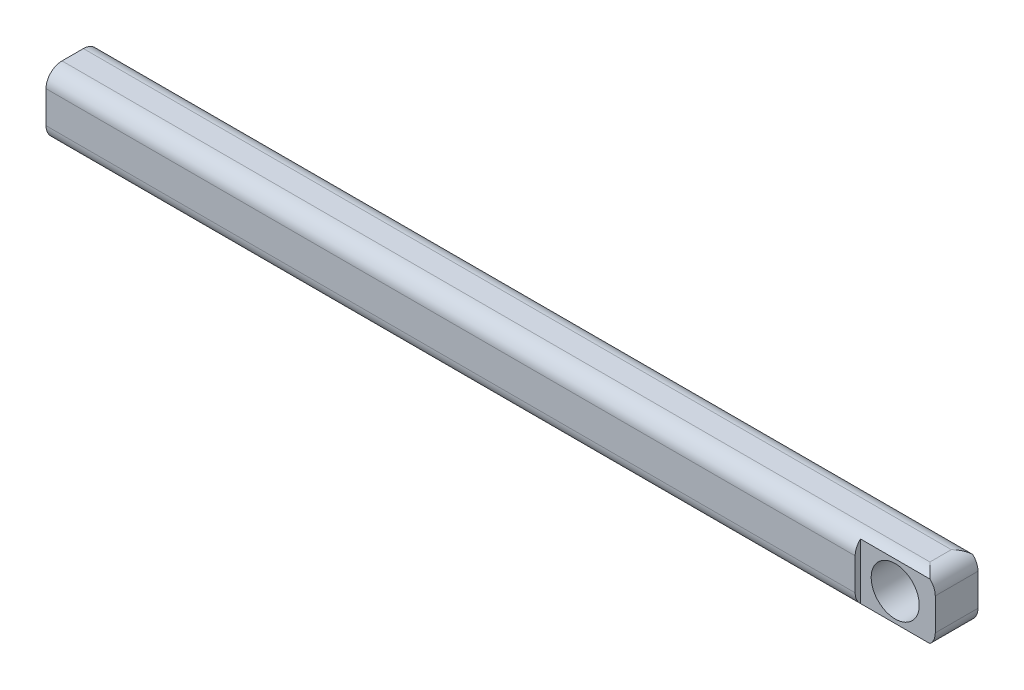
from build123d import *

# Parameters (mm, degrees)
CROQUIS1_W                 = 37.5
CROQUIS1_H                 = 30
SALIENTE_EXTRUIR1_DEPTH    = 15
CROQUIS2_R                 = 2.1
SALIENTE_EXTRUIR2_DEPTH    = 1
SALIENTE_EXTRUIR3_DEPTH    = 35
CROQUIS5_W                 = 18
CROQUIS5_H                 = 12
CROQUIS5_R                 = 4.5
SALIENTE_EXTRUIR4_DEPTH    = 5
CROQUIS6_W                 = 1
CROQUIS6_H                 = 12
CORTAR_EXTRUIR2_DEPTH      = 14
REDONDEO1_R                = 3
REDONDEO2_R                = 3
CORTAR_EXTRUIR3_DEPTH      = 78.447159406
CORTAR_EXTRUIR3_DEPTH_BACK = 78.447159406
CROQUIS7_OUTSIDE_W         = 123.972
CROQUIS7_OUTSIDE_H         = 74.472
CROQUIS7_OUTSIDE_W_2       = 24.163279834
CROQUIS7_OUTSIDE_H_2       = 36.211204922
SALIENTE_EXTRUIR5_DEPTH    = 147.5


with BuildPart() as part:
    # Croquis1 → Saliente-Extruir1 (new body)
    with BuildSketch(Plane.XY):
        Rectangle(CROQUIS1_W, CROQUIS1_H)
    extrude(amount=SALIENTE_EXTRUIR1_DEPTH)

    # Croquis2 → Saliente-Extruir2 (add)
    # profile 1 of 3: a face of its own
    with BuildSketch(Plane.XY):
        with BuildLine():
            Line((-18.75, 3.7), (-26.75, 3.7))
            ThreePointArc((-26.75, 3.7), (-27.457106781, 3.407106781), (-27.75, 2.7))
            Line((-27.75, 2.7), (-27.75, -2.7))
            ThreePointArc((-27.75, -2.7), (-27.457106781, -3.407106781), (-26.75, -3.7))
            Line((-26.75, -3.7), (-18.75, -3.7))
            Line((-18.75, -3.7), (-18.75, 3.7))
        make_face()
        with Locations((-23.25, 0)):
            Circle(CROQUIS2_R, mode=Mode.SUBTRACT)
    # profile 2 of 3: a face of its own
    with BuildSketch(Plane.XY):
        with BuildLine():
            Line((-10, 15), (10, 15))
            Line((10, 15), (10, 24))
            ThreePointArc((10, 24), (9.707106781, 24.707106781), (9, 25))
            Line((9, 25), (-9, 25))
            ThreePointArc((-9, 25), (-9.707106781, 24.707106781), (-10, 24))
            Line((-10, 24), (-10, 15))
        make_face()
        with Locations((-5.5, 20)):
            Circle(CROQUIS2_R, mode=Mode.SUBTRACT)
        with Locations((5.5, 20)):
            Circle(CROQUIS2_R, mode=Mode.SUBTRACT)
    # profile 3 of 3: a face of its own
    with BuildSketch(Plane.XY):
        with BuildLine():
            Line((-9, -25), (9, -25))
            ThreePointArc((9, -25), (9.707106781, -24.707106781), (10, -24))
            Line((10, -24), (10, -15))
            Line((10, -15), (-10, -15))
            Line((-10, -15), (-10, -24))
            ThreePointArc((-10, -24), (-9.707106781, -24.707106781), (-9, -25))
        make_face()
        with Locations(Location((5.5, -20, 0), (0, 0, 180))):
            Circle(CROQUIS2_R, mode=Mode.SUBTRACT)
        with Locations(Location((-5.5, -20, 0), (0, 0, 180))):
            Circle(CROQUIS2_R, mode=Mode.SUBTRACT)
    extrude(amount=SALIENTE_EXTRUIR2_DEPTH)

    # Croquis3 → Saliente-Extruir3 (add)
    with BuildSketch(Plane(origin=(18.75, 0, 0), x_dir=(0, 0, -1), z_dir=(1, 0, 0))):
        with BuildLine():
            Line((-10.5, -12.5), (-4.5, -12.5))
            ThreePointArc((-4.5, -12.5), (-2.378679656, -11.621320344), (-1.5, -9.5))
            Line((-1.5, -9.5), (-1.5, 9.5))
            ThreePointArc((-1.5, 9.5), (-2.378679656, 11.621320344), (-4.5, 12.5))
            Line((-4.5, 12.5), (-10.5, 12.5))
            ThreePointArc((-10.5, 12.5), (-12.621320344, 11.621320344), (-13.5, 9.5))
            Line((-13.5, 9.5), (-13.5, -9.5))
            ThreePointArc((-13.5, -9.5), (-12.621320344, -11.621320344), (-10.5, -12.5))
        make_face()
    extrude(amount=SALIENTE_EXTRUIR3_DEPTH)

    # Croquis5 → Saliente-Extruir4 (add, symmetric)
    with BuildSketch(Plane.XY.offset(7.5)):
        with Locations((62.75, 0)):
            Rectangle(CROQUIS5_W, CROQUIS5_H)
        with Locations((64.25, 0)):
            Circle(CROQUIS5_R, mode=Mode.SUBTRACT)
    extrude(amount=SALIENTE_EXTRUIR4_DEPTH, both=True)

    # Croquis6 → Cortar-Extruir2 (cut)
    with BuildSketch(Plane(origin=(71.75, 0, 0), x_dir=(0, 0, -1), z_dir=(1, 0, 0))):
        with Locations((-12, 0)):
            Rectangle(CROQUIS6_W, CROQUIS6_H)
        with Locations((-3, 0)):
            Rectangle(CROQUIS6_W, CROQUIS6_H)
    extrude(amount=-CORTAR_EXTRUIR2_DEPTH, mode=Mode.SUBTRACT)

    # Redondeo1
    redondeo1_edges = [part.edges().sort_by_distance(p)[0] for p in [
        (71.75, 6, 7.5),
        (71.75, -6, 7.5),
    ]]
    fillet(redondeo1_edges, radius=REDONDEO1_R)

    # Redondeo2
    # the kernel refuses this fillet: 3 mm, written as the material it takes off along each edge
    with BuildSketch(Plane(origin=(75.75, -6, 12.5), x_dir=(0, 1, 0), z_dir=(-1, 0, 0)), Plane(origin=(53.75, 6, 2.5), x_dir=(0, 0, 1), z_dir=(1, 0, 0))) as redondeo2_piece_1:
        with BuildLine():
            CenterArc((REDONDEO2_R, REDONDEO2_R), REDONDEO2_R, 180, 90)
            Line((0, REDONDEO2_R), (-REDONDEO2_R * 0.02, REDONDEO2_R))
            Line((-REDONDEO2_R * 0.02, REDONDEO2_R), (-REDONDEO2_R * 0.02, -REDONDEO2_R * 0.02))
            Line((-REDONDEO2_R * 0.02, -REDONDEO2_R * 0.02), (REDONDEO2_R, -REDONDEO2_R * 0.02))
            Line((REDONDEO2_R, -REDONDEO2_R * 0.02), (REDONDEO2_R, 0))
        make_face()
    extrude(amount=22, mode=Mode.SUBTRACT)
    with BuildSketch(Plane(origin=(75.75, -6, 2.5), x_dir=(0, 1, 0), z_dir=(-1, 0, 0)), Plane(origin=(53.75, 6, 12.5), x_dir=(0, 0, -1), z_dir=(1, 0, 0))) as redondeo2_piece_2:
        with BuildLine():
            CenterArc((REDONDEO2_R, -REDONDEO2_R), REDONDEO2_R, 90, 90)
            Line((0, -REDONDEO2_R), (-REDONDEO2_R * 0.02, -REDONDEO2_R))
            Line((-REDONDEO2_R * 0.02, -REDONDEO2_R), (-REDONDEO2_R * 0.02, REDONDEO2_R * 0.02))
            Line((-REDONDEO2_R * 0.02, REDONDEO2_R * 0.02), (REDONDEO2_R, REDONDEO2_R * 0.02))
            Line((REDONDEO2_R, REDONDEO2_R * 0.02), (REDONDEO2_R, 0))
        make_face()
    extrude(amount=22, mode=Mode.SUBTRACT)

    # Croquis7 outside → Cortar-Extruir3 (cut, two sides: drawn at the far end of the back side and taken through both)
    with BuildSketch(Plane.XY.offset(15).offset(-CORTAR_EXTRUIR3_DEPTH_BACK)):
        with Locations((22, 0)):
            Rectangle(CROQUIS7_OUTSIDE_W, CROQUIS7_OUTSIDE_H)
        with Locations((65.831639917, -3.105602461)):
            Rectangle(CROQUIS7_OUTSIDE_W_2, CROQUIS7_OUTSIDE_H_2, mode=Mode.SUBTRACT)
    extrude(amount=CORTAR_EXTRUIR3_DEPTH + CORTAR_EXTRUIR3_DEPTH_BACK, mode=Mode.SUBTRACT)

    # Croquis10 → Saliente-Extruir5 (add)
    with BuildSketch(Plane.ZY.offset(-53.75)):
        with BuildLine():
            Line((5.5, -6), (9.5, -6))
            ThreePointArc((9.5, -6), (11.621320344, -5.121320344), (12.5, -3))
            Line((12.5, -3), (12.5, 3))
            ThreePointArc((12.5, 3), (11.621320344, 5.121320344), (9.5, 6))
            Line((9.5, 6), (5.5, 6))
            ThreePointArc((5.5, 6), (3.378679656, 5.121320344), (2.5, 3))
            Line((2.5, 3), (2.5, -3))
            ThreePointArc((2.5, -3), (3.378679656, -5.121320344), (5.5, -6))
        make_face()
    extrude(amount=SALIENTE_EXTRUIR5_DEPTH)


solid = part.part
